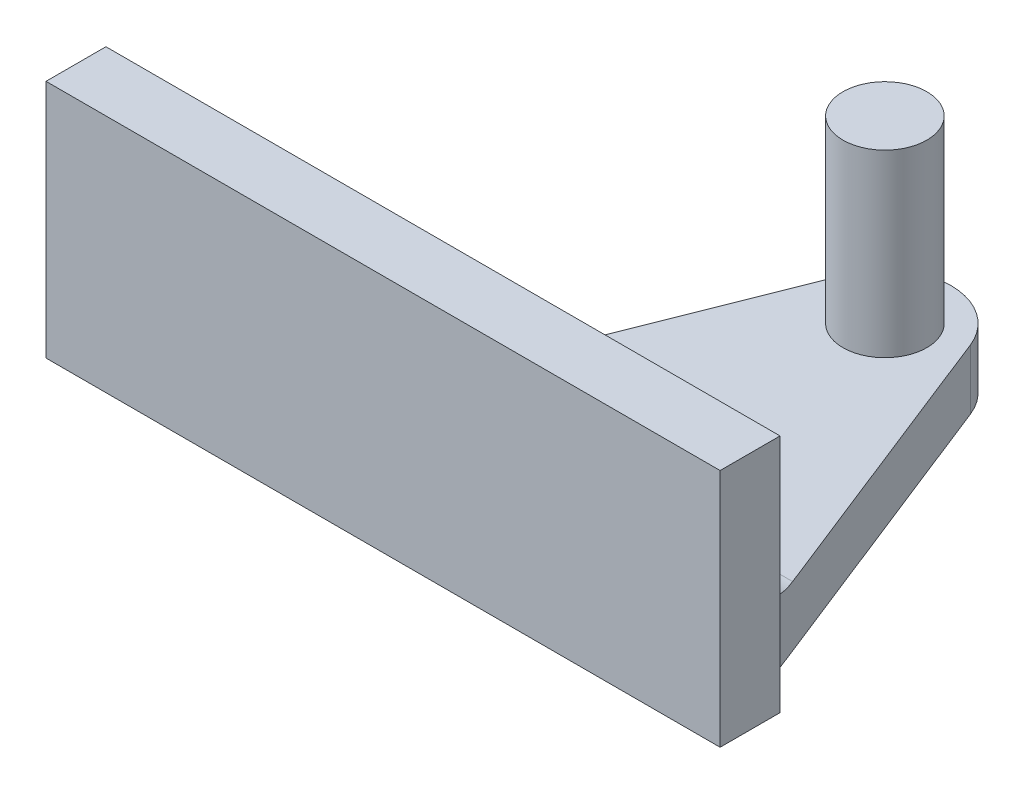
from build123d import *

# Parameters (mm, degrees)
SKETCH1_R           = 11
SKETCH1_R_2         = 7
BOSS_EXTRUDE1_DEPTH = 10
BOSS_EXTRUDE2_START = 10
SKETCH1_3_W         = 112.5
SKETCH1_3_H         = 10
SKETCH1_3_R         = 7
BOSS_EXTRUDE2_DEPTH = 30
FILLET1_R           = 10


with BuildPart() as part:
    # Sketch1 → Boss-Extrude1 (new body)
    # profile 1 of 6: a face of its own
    with BuildSketch(Plane(origin=(0, 0, 0), x_dir=(1, 0, 0), z_dir=(0, 1, 0))):
        Polygon((-37.5, -65), (-33.550296394, -55), (-75, -55), (-75, -65), align=None)
    # profile 2 of 6: a face of its own
    with BuildSketch(Plane(origin=(0, 0, 0), x_dir=(1, 0, 0), z_dir=(0, 1, 0))):
        Polygon((33.550296394, -55), (-33.550296394, -55), (-37.5, -65), (37.5, -65), align=None)
    # profile 3 of 6: a face of its own
    with BuildSketch(Plane(origin=(0, 0, 0), x_dir=(1, 0, 0), z_dir=(0, 1, 0))):
        Polygon((37.5, -55), (33.550296394, -55), (37.5, -65), align=None)
    # profile 4 of 6: a face of its own
    with BuildSketch(Plane(origin=(0, 0, 0), x_dir=(1, 0, 0), z_dir=(0, 1, 0))):
        with BuildLine():
            ThreePointArc((11, 0), (-2.056720175, -10.806012314), (-10.230891295, 4.040898824))
            Line((-10.230891295, 4.040898824), (-33.550296394, -55))
            Line((-33.550296394, -55), (33.550296394, -55))
            Line((33.550296394, -55), (10.230891295, 4.040898824))
            ThreePointArc((10.230891295, 4.040898824), (10.806012314, 2.056720175), (11, 0))
        make_face()
    # profile 5 of 6: a face of its own
    with BuildSketch(Plane(origin=(0, 0, 0), x_dir=(1, 0, 0), z_dir=(0, 1, 0))):
        Circle(SKETCH1_R)
        Circle(SKETCH1_R_2, mode=Mode.SUBTRACT)
    # profile 6 of 6: a face of its own
    with BuildSketch(Plane(origin=(0, 0, 0), x_dir=(1, 0, 0), z_dir=(0, 1, 0))):
        Circle(SKETCH1_R_2)
    extrude(amount=BOSS_EXTRUDE1_DEPTH)

    # Sketch1<3> → Boss-Extrude2 (add)
    with BuildSketch(Plane(origin=(0, 0, 0), x_dir=(1, 0, 0), z_dir=(0, 1, 0)).offset(BOSS_EXTRUDE2_START)):
        with Locations((-18.75, -60)):
            Rectangle(SKETCH1_3_W, SKETCH1_3_H)
        with Locations(Location((0, 0, 0), (0, 0, 270))):
            Circle(SKETCH1_3_R)
    extrude(amount=BOSS_EXTRUDE2_DEPTH)

    # Fillet1
    # the kernel refuses this fillet: 10 mm, written as the material it adds along each edge
    with BuildSketch(Plane(origin=(-33.550296394, 0, 55), x_dir=(-1, 0, 0), z_dir=(0, 1, 0))) as fillet1_piece_1:
        with BuildLine():
            CenterArc((FILLET1_R * 0.680204781295, -FILLET1_R), FILLET1_R, 90, 68.447449105)
            Line((-FILLET1_R * 0.249876245536, -FILLET1_R * 0.632645561443), (-FILLET1_R * 0.268477866073, -FILLET1_R * 0.625298472672))
            Line((-FILLET1_R * 0.268477866073, -FILLET1_R * 0.625298472672), (-FILLET1_R * 0.0136040956259, FILLET1_R * 0.02))
            Line((-FILLET1_R * 0.0136040956259, FILLET1_R * 0.02), (FILLET1_R * 0.680204781295, FILLET1_R * 0.02))
            Line((FILLET1_R * 0.680204781295, FILLET1_R * 0.02), (FILLET1_R * 0.680204781295, 0))
        make_face()
    extrude(amount=10)
    with BuildSketch(Plane(origin=(33.550296394, 0, 55), x_dir=(1, 0, 0), z_dir=(0, 1, 0))) as fillet1_piece_2:
        with BuildLine():
            CenterArc((6.988874819, 9.526984745), FILLET1_R, 201.552550895, 50.754421911)
            Line((-2.31193545, 5.85344036), (-2.497951655, 5.779969472))
            Line((-2.497951655, 5.779969472), (-0.186016205, -0.073470888))
            Line((-0.186016205, -0.073470888), (0, -0.2))
            ThreePointArc((0, -0.2), (1.974851803, -0.2), (3.888920182, -0.190539695))
            Line((3.888920182, -0.190539695), (3.949703606, 0))
        make_face()
    extrude(amount=10)
    with BuildSketch(Plane(origin=(58.550296394, 10, 55), x_dir=(0, 1, 0), z_dir=(-1, 0, 0))) as fillet1_piece_3_section:
        with BuildLine():
            CenterArc((FILLET1_R, FILLET1_R), FILLET1_R, 180, 90)
            Line((0, FILLET1_R), (-FILLET1_R * 0.02, FILLET1_R))
            Line((-FILLET1_R * 0.02, FILLET1_R), (-FILLET1_R * 0.02, -FILLET1_R * 0.02))
            Line((-FILLET1_R * 0.02, -FILLET1_R * 0.02), (FILLET1_R, -FILLET1_R * 0.02))
            Line((FILLET1_R, -FILLET1_R * 0.02), (FILLET1_R, 0))
        make_face()
    fillet1_piece_3 = extrude(amount=117.100592788, mode=Mode.PRIVATE)
    fillet1_piece_3 = split(fillet1_piece_3, bisect_by=Plane(origin=(28.268391296, 12.297159596, 41.627084904), z_dir=(-0.9300810268318512, 0, 0.3673544385568373)), keep=Keep.TOP, mode=Mode.PRIVATE)
    fillet1_piece_3 = split(fillet1_piece_3, bisect_by=Plane(origin=(-28.268391296, 12.297159596, 41.627084904), z_dir=(0.9300810268318513, 0, 0.36735443855683725)), keep=Keep.TOP, mode=Mode.PRIVATE)
    add(fillet1_piece_3)
    with BuildSketch(Plane(origin=(-33.550296394, 0, 55), x_dir=(-1, 0, 0), z_dir=(0, 1, 0))) as fillet1_piece_4a_section:
        with BuildLine():
            CenterArc((FILLET1_R * 0.680204781295, -FILLET1_R), FILLET1_R, 90, 68.447449105)
            Line((-FILLET1_R * 0.249876245536, -FILLET1_R * 0.632645561443), (-FILLET1_R * 0.268477866073, -FILLET1_R * 0.625298472672))
            Line((-FILLET1_R * 0.268477866073, -FILLET1_R * 0.625298472672), (-FILLET1_R * 0.0136040956259, FILLET1_R * 0.02))
            Line((-FILLET1_R * 0.0136040956259, FILLET1_R * 0.02), (FILLET1_R * 0.680204781295, FILLET1_R * 0.02))
            Line((FILLET1_R * 0.680204781295, FILLET1_R * 0.02), (FILLET1_R * 0.680204781295, 0))
        make_face()
    fillet1_piece_4a = extrude(amount=27.005119532, mode=Mode.PRIVATE)
    fillet1_piece_4a = split(fillet1_piece_4a, bisect_by=Plane(origin=(-34.492064323, 10, 53.615464114), z_dir=(0, 1, 0)), keep=Keep.TOP, mode=Mode.PRIVATE)
    with BuildSketch(Plane(origin=(58.550296394, 10, 55), x_dir=(0, 1, 0), z_dir=(-1, 0, 0))) as fillet1_piece_4b_section:
        with BuildLine():
            CenterArc((FILLET1_R, FILLET1_R), FILLET1_R, 180, 90)
            Line((0, FILLET1_R), (-FILLET1_R * 0.02, FILLET1_R))
            Line((-FILLET1_R * 0.02, FILLET1_R), (-FILLET1_R * 0.02, -FILLET1_R * 0.02))
            Line((-FILLET1_R * 0.02, -FILLET1_R * 0.02), (FILLET1_R, -FILLET1_R * 0.02))
            Line((FILLET1_R, -FILLET1_R * 0.02), (FILLET1_R, 0))
        make_face()
    fillet1_piece_4b = extrude(amount=117.100592788, mode=Mode.PRIVATE)
    fillet1_piece_4b = split(fillet1_piece_4b, bisect_by=Plane(origin=(-34.377193324, 12.222070762, 57.093567044), z_dir=(-0.9300810268318513, 0, -0.36735443855683725)), keep=Keep.TOP, mode=Mode.PRIVATE)
    fillet1_piece_4 = fillet1_piece_4a & fillet1_piece_4b
    add(fillet1_piece_4)
    with BuildSketch(Plane(origin=(58.550296394, 10, 55), x_dir=(0, 1, 0), z_dir=(-1, 0, 0))) as fillet1_piece_5a_section:
        with BuildLine():
            CenterArc((FILLET1_R, FILLET1_R), FILLET1_R, 180, 90)
            Line((0, FILLET1_R), (-FILLET1_R * 0.02, FILLET1_R))
            Line((-FILLET1_R * 0.02, FILLET1_R), (-FILLET1_R * 0.02, -FILLET1_R * 0.02))
            Line((-FILLET1_R * 0.02, -FILLET1_R * 0.02), (FILLET1_R, -FILLET1_R * 0.02))
            Line((FILLET1_R, -FILLET1_R * 0.02), (FILLET1_R, 0))
        make_face()
    fillet1_piece_5a = extrude(amount=117.100592788, mode=Mode.PRIVATE)
    fillet1_piece_5a = split(fillet1_piece_5a, bisect_by=Plane(origin=(37.5, 12.040069704, 52.357079342), z_dir=(-1, 0, 0)), keep=Keep.TOP, mode=Mode.PRIVATE)
    fillet1_piece_5a = split(fillet1_piece_5a, bisect_by=Plane(origin=(32.843361018, 12.040069704, 53.210155884), z_dir=(0.9300810268318512, 0, -0.3673544385568373)), keep=Keep.TOP, mode=Mode.PRIVATE)
    with BuildSketch(Plane(origin=(33.550296394, 0, 55), x_dir=(1, 0, 0), z_dir=(0, 1, 0))) as fillet1_piece_5b_section:
        with BuildLine():
            CenterArc((6.988874819, 9.526984745), FILLET1_R, 201.552550895, 50.754421911)
            Line((-2.31193545, 5.85344036), (-2.497951655, 5.779969472))
            Line((-2.497951655, 5.779969472), (-0.186016205, -0.073470888))
            Line((-0.186016205, -0.073470888), (0, -0.2))
            ThreePointArc((0, -0.2), (1.974851803, -0.2), (3.888920182, -0.190539695))
            Line((3.888920182, -0.190539695), (3.949703606, 0))
        make_face()
    fillet1_piece_5b = extrude(amount=25.733683924, mode=Mode.PRIVATE)
    fillet1_piece_5b = split(fillet1_piece_5b, bisect_by=Plane(origin=(33.943390061, 10, 53.584203188), z_dir=(0, 1, 0)), keep=Keep.TOP, mode=Mode.PRIVATE)
    fillet1_piece_5 = fillet1_piece_5a & fillet1_piece_5b
    add(fillet1_piece_5)


solid = part.part
